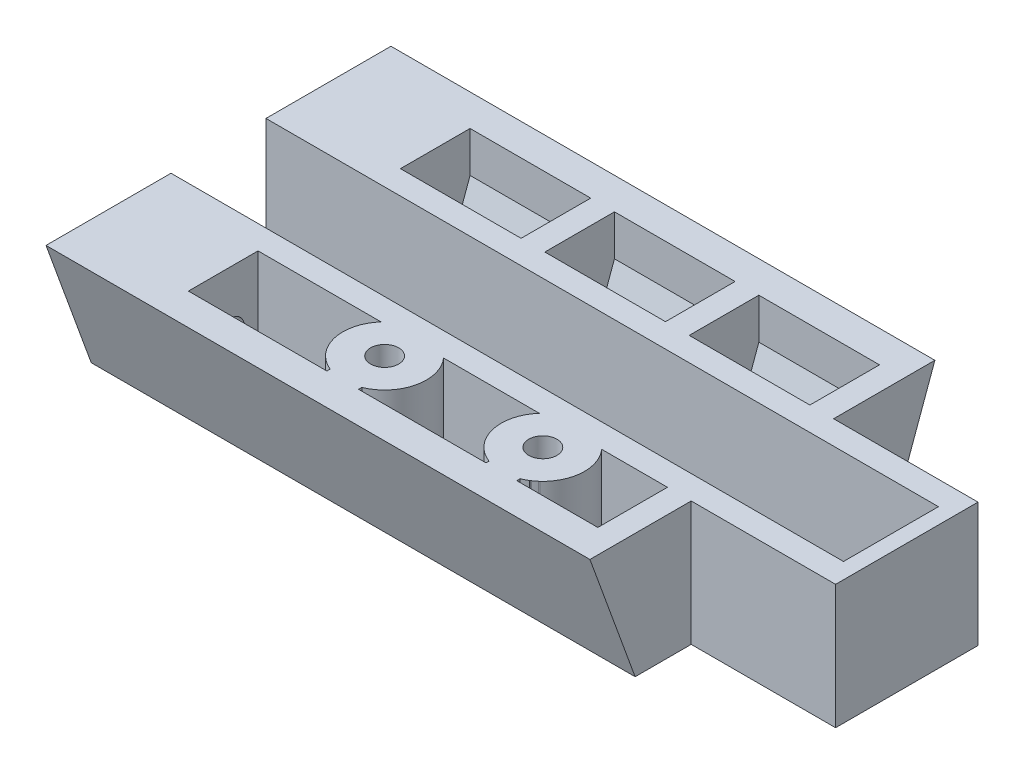
from build123d import *
from OCP.BRepAlgoAPI import BRepAlgoAPI_Cut
from OCP.TopTools import TopTools_ListOfShape

# Parameters (mm, degrees)
SKETCH_283_W           = 8.41374588
SKETCH_283_H           = 7.619999886
EXTRUDE_5712_DEPTH     = 9.9695
SKETCH_4_W             = 9.683748245
SKETCH_4_H             = 5.588000536
SKETCH_4_W_2           = 9.683750153
SKETCH_4_W_3           = 1.905002594
SKETCH_4_H_2           = 7.619999886
SKETCH_4_W_4           = 43.656253815
CUT_EXTRUDE_5770_DEPTH = 8.6995
CUT_EXTRUDE_9_DEPTH    = 63.593257627
EXTRUDE_10_REACH       = 64.593
CUT_EXTRUDE_11_REACH   = 64.593
SKETCH_7_R             = 1.130300066
SKETCH_5_R             = 1.13029956
SKETCH_5_R_2           = 1.130299504
CUT_EXTRUDE_12_DEPTH   = 63.593257627


with BuildPart() as part:
    # Sketch 283 → Extrude 5712 (new body)
    with BuildSketch(Plane(origin=(0, 0, 0), x_dir=(1, 0, 0), z_dir=(0, 1, 0))):
        Polygon((43.656253815, 0), (0, 0), (0, -27.686000824), (43.656253815, -27.686000824), (43.656253815, -19.557998657), (55.245002747, -19.557998657), (55.245002747, -8.128000259), (43.656253815, -8.128000259), align=None)
        with Locations((47.863126755, -13.842999935)):
            Rectangle(SKETCH_283_W, SKETCH_283_H, mode=Mode.SUBTRACT)
    extrude(amount=EXTRUDE_5712_DEPTH)


with BuildPart() as cut_extrude_5770_tool:
    # 草图4 → Cut-Extrude 5770 (new body)
    with BuildSketch(Plane(origin=(0, 9.969499588, 0), x_dir=(1, 0, 0), z_dir=(0, 1, 0))):
        with Locations((13.73187542, -5.333999991)):
            Rectangle(SKETCH_4_W, SKETCH_4_H)
        with Locations((25.320626258, -5.333999991)):
            Rectangle(SKETCH_4_W, SKETCH_4_H)
        with Locations((36.909376145, -5.333999991)):
            Rectangle(SKETCH_4_W_2, SKETCH_4_H)
        with Locations((53.022500992, -13.842999935)):
            Rectangle(SKETCH_4_W_3, SKETCH_4_H_2)
        with Locations((21.828126907, -13.842999935)):
            Rectangle(SKETCH_4_W_4, SKETCH_4_H_2)
        with BuildLine():
            ThreePointArc((18.220330198, -23.168134689), (17.956836473, -21.282857597), (18.762168884, -19.557998657))
            Line((18.762168884, -19.557998657), (8.890001297, -19.557998657))
            Line((8.890001297, -19.557998657), (8.890001297, -23.168134689))
            Line((8.890001297, -23.168134689), (18.220330198, -23.168134689))
        make_face()
        with BuildLine():
            ThreePointArc((20.002500534, -24.883461506), (18.947446601, -24.196156461), (18.220330198, -23.168134689))
            Line((18.220330198, -23.168134689), (8.890001297, -23.168134689))
            Line((8.890001297, -23.168134689), (8.890001297, -25.145999908))
            Line((8.890001297, -25.145999908), (20.002500534, -25.145999908))
            Line((20.002500534, -25.145999908), (20.002500534, -24.883461506))
        make_face()
        with BuildLine():
            ThreePointArc((30.927521198, -23.168134689), (30.663518149, -21.282433428), (31.470916179, -19.557998657))
            Line((31.470916179, -19.557998657), (23.782831176, -19.557998657))
            ThreePointArc((23.782831176, -19.557998657), (24.407616627, -20.592090361), (24.625300686, -21.78049945))
            ThreePointArc((24.625300686, -21.78049945), (24.549281168, -22.490413257), (24.324669862, -23.168134689))
            Line((24.324669862, -23.168134689), (30.927521198, -23.168134689))
        make_face()
        with BuildLine():
            ThreePointArc((32.772350311, -24.904129054), (31.679314783, -24.217449589), (30.927521198, -23.168134689))
            Line((30.927521198, -23.168134689), (24.324669862, -23.168134689))
            ThreePointArc((24.324669862, -23.168134689), (23.597554208, -24.19615574), (22.54250145, -24.883460719))
            Line((22.54250145, -24.883460719), (22.54250145, -25.145999908))
            Line((22.54250145, -25.145999908), (32.772350311, -25.145999908))
            Line((32.772350311, -25.145999908), (32.772350311, -24.904129054))
        make_face()
        with BuildLine():
            Line((41.751251221, -25.145999908), (41.751251221, -23.168134689))
            Line((41.751251221, -23.168134689), (37.017476717, -23.168134689))
            ThreePointArc((37.017476717, -23.168134689), (36.671360521, -23.758773077), (36.212287817, -24.266613976))
            Line((36.212287817, -24.266613976), (36.221363068, -24.267242432))
            Line((36.221363068, -24.267242432), (36.150205492, -24.321171358))
            ThreePointArc((36.150205492, -24.321171358), (35.993676848, -24.447381385), (35.8298504, -24.563962181))
            Line((35.8298504, -24.563962181), (35.758705139, -24.617881775))
            Line((35.758705139, -24.617881775), (35.749340746, -24.616033322))
            ThreePointArc((35.749340746, -24.616033322), (35.501472205, -24.757017499), (35.242500305, -24.876386285))
            Line((35.242500305, -24.876386285), (35.242500305, -25.145999908))
            Line((35.242500305, -25.145999908), (41.751251221, -25.145999908))
        make_face()
        with BuildLine():
            Line((41.751251221, -23.168134689), (41.751251221, -19.557998657))
            Line((41.751251221, -19.557998657), (36.474081737, -19.557998657))
            ThreePointArc((36.474081737, -19.557998657), (37.10046612, -20.591699149), (37.318754037, -21.780498749))
            ThreePointArc((37.318754037, -21.780498749), (37.242567409, -22.490481412), (37.017476717, -23.168134689))
            Line((37.017476717, -23.168134689), (41.751251221, -23.168134689))
        make_face()
    extrude(amount=-CUT_EXTRUDE_5770_DEPTH)


with BuildPart() as part_1:
    add(part.part)

    # Cut-Extrude 5770: cut by cut_extrude_5770_tool, with a tolerance
    cut_extrude_5770_stock = TopTools_ListOfShape()
    cut_extrude_5770_stock.Append(part_1.part.wrapped)
    cut_extrude_5770_tools = TopTools_ListOfShape()
    cut_extrude_5770_tools.Append(cut_extrude_5770_tool.part.wrapped)
    cut_extrude_5770_cut = BRepAlgoAPI_Cut()
    cut_extrude_5770_cut.SetArguments(cut_extrude_5770_stock)
    cut_extrude_5770_cut.SetTools(cut_extrude_5770_tools)
    cut_extrude_5770_cut.SetFuzzyValue(0.00001)
    cut_extrude_5770_cut.Build()
    add(Compound.cast(cut_extrude_5770_cut.Shape()).solids(), mode=Mode.REPLACE)

    # Sketch 3431 → 拉伸9 (cut, through all)
    with BuildSketch(Plane(origin=(0, 0, 0), x_dir=(0, 0, -1), z_dir=(1, 0, 0))):
        Polygon((0, 0), (-3.628601313, 0), (0, 9.969499588), align=None)
    cut_extrude_9 = extrude(amount=CUT_EXTRUDE_9_DEPTH, mode=Mode.SUBTRACT)

    # 拉伸10: up to this face of the body (flat: up to its plane)
    extrude_10_end = Plane(part_1.part.faces().sort_by_distance((43.656253815, 5.462221292, 4.884257746))[0])
    # 右视标记<6> → 拉伸10 (add, up to the picked face)
    with BuildSketch(Plane(origin=(0, 0, 0), x_dir=(0, 0, -1), z_dir=(1, 0, 0)), mode=Mode.PRIVATE) as extrude_10_sk1:
        Polygon((-8.128000259, 1.269999862), (-8.128000259, 0), (-3.628601313, 0), (0, 9.969499588), (-2.539999723, 9.969499588), (-2.539999723, 6.704138756), (-4.517864227, 1.269999862), align=None)
    extrude_10_tool1 = split(extrude(extrude_10_sk1.sketch, amount=EXTRUDE_10_REACH, mode=Mode.PRIVATE), bisect_by=extrude_10_end, keep=Keep.BOTH, mode=Mode.PRIVATE)
    extrude_10 = extrude_10_tool1.solids().sort_by(Axis((0, 4.424317, 3.31525), (1, 0, 0)))[0]
    add(extrude_10)

    # 右视标记<7> → 拉伸11 (cut, up to next)
    with BuildSketch(Plane(origin=(0, 0, 0), x_dir=(0, 0, -1), z_dir=(1, 0, 0)), mode=Mode.PRIVATE) as cut_extrude_11_sk1:
        with Locations(Location((-5.905499899, 5.258642622, 0), (0, 0, 180))):
            Circle(SKETCH_7_R)
    cut_extrude_11_tool1 = extrude(cut_extrude_11_sk1.sketch, amount=CUT_EXTRUDE_11_REACH, mode=Mode.PRIVATE) & part_1.part
    cut_extrude_11 = cut_extrude_11_tool1.solids().sort_by_distance((0, 5.258643, 5.9055))[0]
    add(cut_extrude_11, mode=Mode.SUBTRACT)

    # 镜向2: 拉伸9, 拉伸10, 拉伸11 across plane
    add(cut_extrude_9.mirror(Plane.XY.offset(13.843000412)), mode=Mode.SUBTRACT)
    add(extrude_10.mirror(Plane.XY.offset(13.843000412)))
    add(cut_extrude_11.mirror(Plane.XY.offset(13.843000412)), mode=Mode.SUBTRACT)

    # 上视标记<5> → 拉伸12 (cut, through all)
    with BuildSketch(Plane(origin=(0, 0, 0), x_dir=(1, 0, 0), z_dir=(0, 1, 0))):
        with Locations(Location((21.27250003, -21.78049945, 0), (0, 0, 270))):
            Circle(SKETCH_5_R)
        with Locations(Location((33.972498958, -21.780498749, 0), (0, 0, 270))):
            Circle(SKETCH_5_R_2)
    extrude(amount=CUT_EXTRUDE_12_DEPTH, mode=Mode.SUBTRACT)


solid = part_1.part
